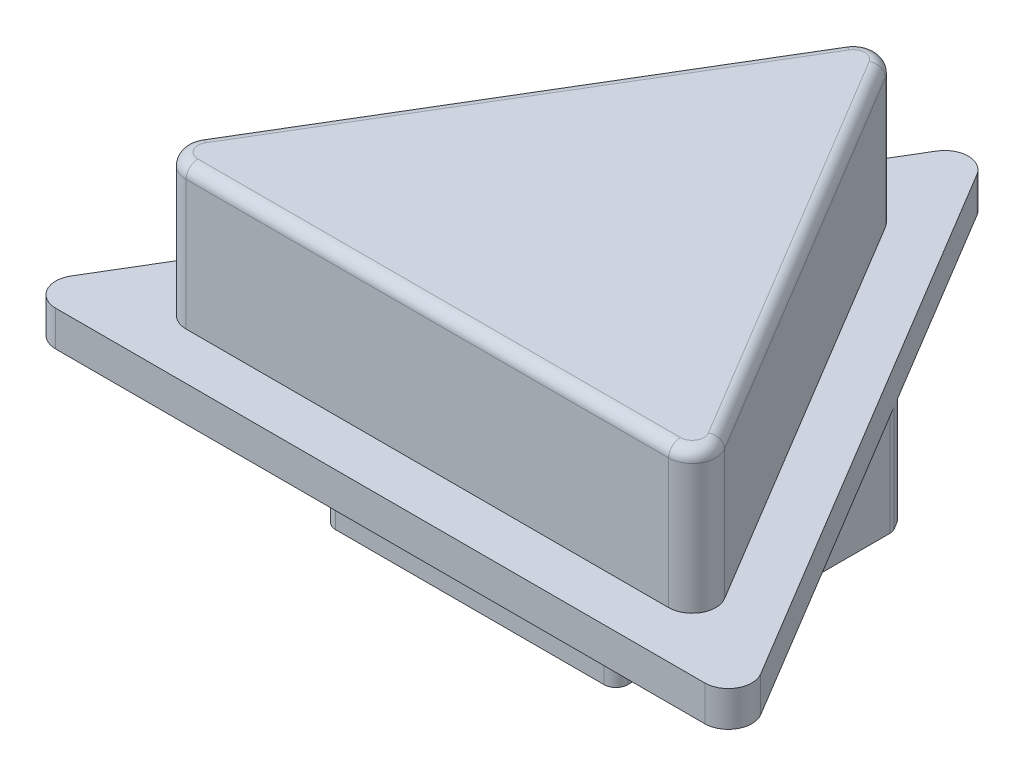
from build123d import *

# Parameters (mm, degrees)
BOSS_EXTRUDE1_DEPTH = 3
BOSS_EXTRUDE2_DEPTH = 0.75
BOSS_EXTRUDE3_DEPTH = 2.25
FILLET1_R           = 0.5
FILLET2_R           = 0.5
FILLET4_R           = 0.25
FILLET6_R           = 0.25


with BuildPart() as part:
    # Sketch1 → Boss-Extrude1 (new body)
    with BuildSketch(Plane(origin=(0, 0, 0), x_dir=(1, 0, 0), z_dir=(0, 1, 0))):
        Polygon((0, 0), (6, 10), (12, 2.4e-16), align=None)
    extrude(amount=BOSS_EXTRUDE1_DEPTH)

    # Sketch2 → Boss-Extrude2 (add)
    with BuildSketch(Plane.XZ):
        Polygon((13.766190378969059, 0.9999999999999998), (-1.7661903789690598, 1), (5.999999999999999, -11.943650631615101), align=None)
    extrude(amount=BOSS_EXTRUDE2_DEPTH)

    # Sketch3 → Boss-Extrude3 (add)
    with BuildSketch(Plane.XZ.offset(0.75)):
        Polygon((3.09380962103094, -7.1000000000000005), (8.90619037896906, -7.1), (9.1, -6.776983964948434), (9.1, -0.8999999999999984), (2.9000000000000004, -0.8999999999999991), (2.900000000000001, -6.776983964948436), align=None)
        Polygon((3.9000000000000004, -1.899999999999999), (8.099999999999998, -1.8999999999999986), (8.1, -6.1), (3.9000000000000004, -6.1), align=None, mode=Mode.SUBTRACT)
    extrude(amount=BOSS_EXTRUDE3_DEPTH)

    # Fillet1
    fillet1_edges = [part.edges().sort_by_distance(p)[0] for p in [
        (5.999999999999999, -0.375, -11.943650631615101),
        (-1.7661903789690598, -0.375, 1),
        (13.766190378969059, -0.375, 0.9999999999999998),
    ]]
    fillet(fillet1_edges, radius=FILLET1_R)

    # Fillet2
    fillet2_edges = [part.edges().sort_by_distance(p)[0] for p in [
        (0, 1.5, 0),
        (12, 1.5, -2.4e-16),
        (6, 1.5, -10),
    ]]
    fillet(fillet2_edges, radius=FILLET2_R)

    # Fillet4
    fillet4_edges = [part.edges().sort_by_distance(p)[0] for p in [
        (6.000000000000001, 3, -9.528174684192452),
        (8.987198868114007, 3, -5.021335219809989),
        (11.552004763892208, 3, -0.25365059250820254),
        (6, 3, -1.2e-16),
        (0.44799523610779024, 3, -0.2536505925082033),
        (3.0128011318859933, 3, -5.0213352198099885),
    ]]
    fillet(fillet4_edges, radius=FILLET4_R)

    # Fillet6
    fillet6_edges = [part.edges().sort_by_distance(p)[0] for p in [
        (2.9000000000000004, -1.875, -0.8999999999999991),
        (2.9000000000000012, -1.875, -6.776983964948436),
        (3.09380962103094, -1.875, -7.1),
        (8.90619037896906, -1.875, -7.1),
        (9.1, -1.875, -6.776983964948434),
        (9.1, -1.875, -0.8999999999999984),
    ]]
    fillet(fillet6_edges, radius=FILLET6_R)


solid = part.part
